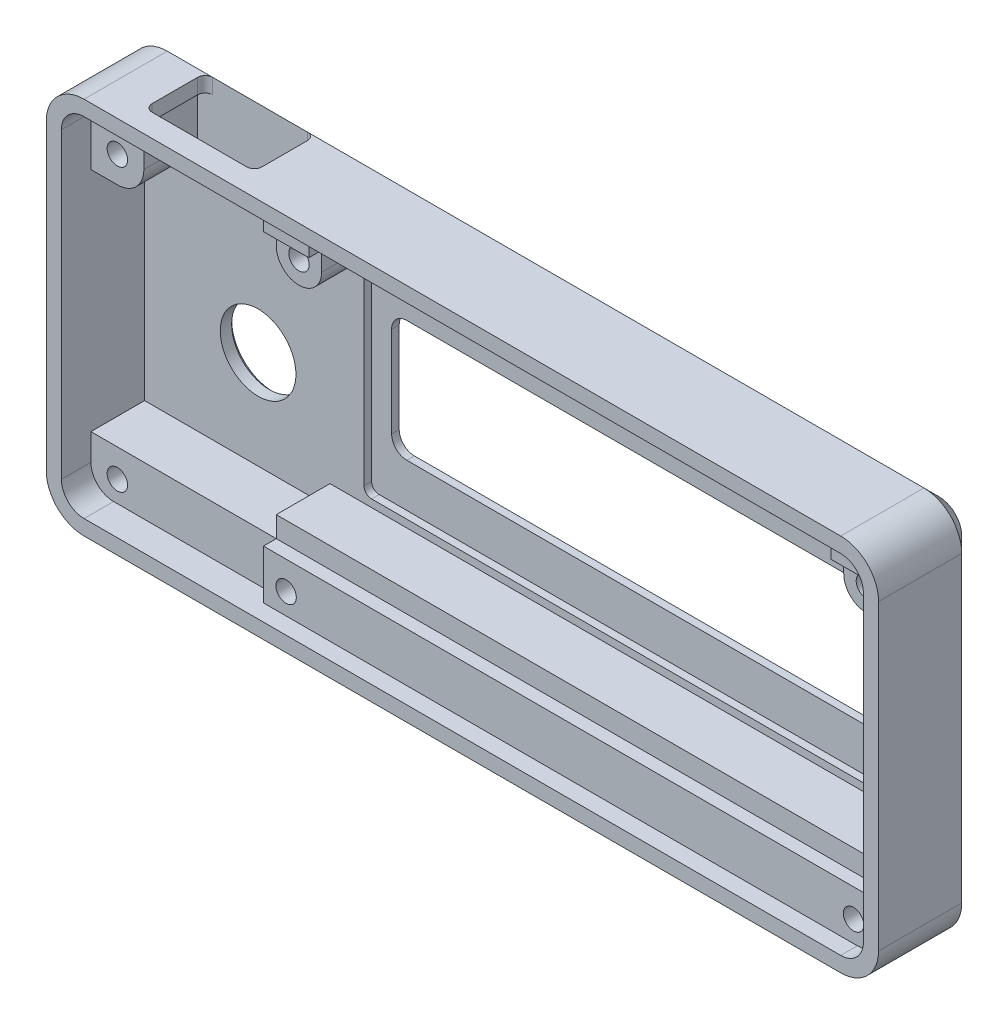
from build123d import *

# Parameters (mm, degrees)
SKICA1_W                    = 110
SKICA1_H                    = 50
P_IDAT_VYSUNUT_M1_DEPTH     = 13
SKO_EPINA1_T                = -2
SKICA3_W                    = 66.7
SKICA3_H                    = 16
ODEBRAT_VYSUNUT_M1_DEPTH    = 2
SKICA6_R                    = 1.35
SKICA6_W                    = 81.5
SKICA6_H                    = 9.25
P_IDAT_VYSUNUT_M3_DEPTH     = 7.1
SKICA8_W                    = 72
SKICA8_H                    = 27.5
ODEBRAT_VYSUNUT_M2_DEPTH    = 1
ZAOBLIT3_R                  = 1
ZAOBLIT4_R                  = 2
SKICA9_W                    = 81.5
SKICA9_H                    = 6.5
P_IDAT_VYSUNUT_M4_DEPTH     = 1.7
SKICA10_R                   = 1.35
ODEBRAT_VYSUNUT_M3_DEPTH    = 8.8
ZAOBLIT5_R                  = 5
ZAOBLIT6_R                  = 3
SKICA11_R                   = 5
ODEBRAT_VYSUNUT_M4_DEPTH    = 2
ZKOSEN_1_SIZE               = 2
P_IDAT_VYSUNUT_M5_OUTLINE_R = 1.35
P_IDAT_VYSUNUT_M5_DEPTH     = 7.1
SKICA13_W                   = 14.5
SKICA13_H                   = 8
ODEBRAT_VYSUNUT_M5_DEPTH    = 2
ZAOBLIT7_R                  = 1
ZAOBLIT8_R                  = 1
P_IDAT_START                = 1.7
SKICA14_W                   = 6
SKICA14_H                   = 3.5
P_IDAT_VYSUNUT_M6_DEPTH     = 1.7


# Read off the part's stored shape, not the designer's step: Přidat vysunutím5
with BuildPart() as part:
    # Skica1 → Přidat vysunutím1 (new body)
    with BuildSketch(Plane.XY):
        with Locations((55, 25)):
            Rectangle(SKICA1_W, SKICA1_H)
    extrude(amount=P_IDAT_VYSUNUT_M1_DEPTH)

    # Skořepina1
    sko_epina1_openings = [part.faces().sort_by_distance(p)[0] for p in [
        (55, 25, 13),
    ]]
    offset(amount=SKO_EPINA1_T, openings=sko_epina1_openings, kind=Kind.INTERSECTION)

    # Skica3 → Odebrat vysunutím1 (cut)
    with BuildSketch(Plane.XY.offset(2)):
        with Locations((67, 26)):
            Rectangle(SKICA3_W, SKICA3_H)
    extrude(amount=-ODEBRAT_VYSUNUT_M1_DEPTH, mode=Mode.SUBTRACT)

    # Skica6 → Přidat vysunutím3 (add)
    # profile 1 of 3: a face of its own
    with BuildSketch(Plane.XY.offset(2)):
        with BuildLine():
            Line((26.5, 42), (26.5, 48))
            Line((26.5, 48), (32.5, 48))
            Line((32.5, 48), (32.5, 42))
            ThreePointArc((32.5, 42), (29.5, 39), (26.5, 42))
        make_face()
        with Locations((29.5, 42)):
            Circle(SKICA6_R, mode=Mode.SUBTRACT)
    # profile 2 of 3: a face of its own
    with BuildSketch(Plane.XY.offset(2)):
        with BuildLine():
            Line((101.5, 42), (101.5, 48))
            Line((101.5, 48), (108, 48))
            Line((108, 48), (108, 39))
            Line((108, 39), (104.5, 39))
            ThreePointArc((104.5, 39), (102.378679656, 39.878679656), (101.5, 42))
        make_face()
        with Locations((104.5, 42)):
            Circle(SKICA6_R, mode=Mode.SUBTRACT)
    # profile 3 of 3: a face of its own
    with BuildSketch(Plane.XY.offset(2)):
        with Locations((67.25, 6.625)):
            Rectangle(SKICA6_W, SKICA6_H)
    extrude(amount=P_IDAT_VYSUNUT_M3_DEPTH)

    # Skica8 → Odebrat vysunutím2 (cut)
    with BuildSketch(Plane.XY.offset(2)):
        with Locations((67, 26)):
            Rectangle(SKICA8_W, SKICA8_H)
    extrude(amount=-ODEBRAT_VYSUNUT_M2_DEPTH, mode=Mode.SUBTRACT)

    # Zaoblit3
    # the kernel refuses this fillet: 1 mm, written as the material it adds along each edge
    with BuildSketch(Plane(origin=(31, 12.25, 2), x_dir=(1, 0, 0), z_dir=(0, 0, -1)), Plane(origin=(31, 39.75, 2), x_dir=(0, -1, 0), z_dir=(0, 0, -1))) as zaoblit3_piece_1:
        with BuildLine():
            CenterArc((ZAOBLIT3_R, -ZAOBLIT3_R), ZAOBLIT3_R, 90, 90)
            Line((0, -ZAOBLIT3_R), (0, 0))
            Line((0, 0), (ZAOBLIT3_R, 0))
        make_face()
    extrude(amount=1)
    with BuildSketch(Plane(origin=(103, 39.75, 2), x_dir=(0, -1, 0), z_dir=(0, 0, -1)), Plane(origin=(103, 12.25, 2), x_dir=(-1, 0, 0), z_dir=(0, 0, -1))) as zaoblit3_piece_2:
        with BuildLine():
            CenterArc((ZAOBLIT3_R, ZAOBLIT3_R), ZAOBLIT3_R, 180, 90)
            Line((0, ZAOBLIT3_R), (0, 0))
            Line((0, 0), (ZAOBLIT3_R, 0))
        make_face()
    extrude(amount=1)

    # Zaoblit4
    zaoblit4_edges = [part.edges().sort_by_distance(p)[0] for p in [
        (100.35, 18, 0.5),
        (100.35, 34, 0.5),
        (33.65, 34, 0.5),
        (33.65, 18, 0.5),
    ]]
    fillet(zaoblit4_edges, radius=ZAOBLIT4_R)

    # Skica9 → Přidat vysunutím4 (add)
    with BuildSketch(Plane.XY.offset(9.1)):
        with Locations((67.25, 5.25)):
            Rectangle(SKICA9_W, SKICA9_H)
    extrude(amount=P_IDAT_VYSUNUT_M4_DEPTH)

    # Skica10 → Odebrat vysunutím3 (cut)
    with BuildSketch(Plane.XY.offset(10.8)):
        with Locations((104.5, 4.796123071)):
            Circle(SKICA10_R)
        with Locations((29.5, 4.796123071)):
            Circle(SKICA10_R)
    extrude(amount=-ODEBRAT_VYSUNUT_M3_DEPTH, mode=Mode.SUBTRACT)

    # Zaoblit5
    zaoblit5_edges = [part.edges().sort_by_distance(p)[0] for p in [
        (0, 50, 6.5),
        (110, 50, 6.5),
        (110, 0, 6.5),
        (0, 0, 6.5),
    ]]
    fillet(zaoblit5_edges, radius=ZAOBLIT5_R)

    # Zaoblit6
    zaoblit6_edges = [part.edges().sort_by_distance(p)[0] for p in [
        (2, 48, 7.5),
        (2, 2, 7.5),
        (108, 2, 11.9),
        (108, 48, 11.05),
    ]]
    fillet(zaoblit6_edges, radius=ZAOBLIT6_R)

    # Skica11 → Odebrat vysunutím4 (cut)
    with BuildSketch(Plane(origin=(0, 0, 0), x_dir=(-1, 0, 0), z_dir=(0, 0, -1))):
        with Locations((-17, 21.5)):
            Circle(SKICA11_R)
    extrude(amount=-ODEBRAT_VYSUNUT_M4_DEPTH, mode=Mode.SUBTRACT)

    # Zkosení1
    zkosen_1_edges = [part.edges().sort_by_distance(p)[0] for p in [
        (55, 0, 0),
        (0, 25, 0),
        (55, 50, 0),
        (110, 25, 0),
        (1.464466094, 48.535533906, 0),
        (108.535533906, 48.535533906, 0),
        (108.535533906, 1.464466094, 0),
        (1.464466094, 1.464466094, 0),
    ]]
    chamfer(zkosen_1_edges, length=ZKOSEN_1_SIZE)

    # Přidat vysunutím5 outline → Přidat vysunutím5 (add)
    # profile 1 of 2: a face of its own
    with BuildSketch(Plane.XY.offset(2)):
        with BuildLine():
            Line((2, 45), (2, 38.5))
            Line((2, 38.5), (5.5, 38.5))
            ThreePointArc((5.5, 38.5), (7.974873734, 39.525126266), (9, 42))
            Line((9, 42), (9, 48))
            Line((9, 48), (5, 48))
            ThreePointArc((5, 48), (2.878679656, 47.121320344), (2, 45))
        make_face()
        with Locations((5.5, 42)):
            Circle(P_IDAT_VYSUNUT_M5_OUTLINE_R, mode=Mode.SUBTRACT)
    # profile 2 of 2: a face of its own
    with BuildSketch(Plane.XY.offset(2)):
        with BuildLine():
            Line((26.5, 8.5), (2, 8.5))
            Line((2, 8.5), (2, 5))
            ThreePointArc((2, 5), (2.878679656, 2.878679656), (5, 2))
            Line((5, 2), (26.5, 2))
            Line((26.5, 2), (26.5, 8.5))
        make_face()
        with Locations((5.5, 4.796123071)):
            Circle(P_IDAT_VYSUNUT_M5_OUTLINE_R, mode=Mode.SUBTRACT)
    extrude(amount=P_IDAT_VYSUNUT_M5_DEPTH)

    # P_idat vysunut_m5 2 outline → P_idat vysunut_m5 2 (revolve, cut)
    with BuildSketch(Plane(origin=(17, 21.5, 0), x_dir=(1, 0, 0), z_dir=(0, -1, 0))):
        Polygon((5.5, 0), (5, 0.5), (5, 0), align=None)
    revolve(axis=Axis((17, 21.5, 0), (0, 0, 1)), mode=Mode.SUBTRACT)

    # Skica13 → Odebrat vysunutím5 (cut)
    with BuildSketch(Plane.XZ.offset(-48)):
        with Locations((17.25, 6)):
            Rectangle(SKICA13_W, SKICA13_H)
    extrude(amount=-ODEBRAT_VYSUNUT_M5_DEPTH, mode=Mode.SUBTRACT)

    # Zaoblit7
    zaoblit7_edges = [part.edges().sort_by_distance(p)[0] for p in [
        (10, 49, 10),
        (24.5, 49, 10),
    ]]
    fillet(zaoblit7_edges, radius=ZAOBLIT7_R)

    # Zaoblit8
    zaoblit8_edges = [part.edges().sort_by_distance(p)[0] for p in [
        (10, 49, 2),
        (24.5, 49, 2),
    ]]
    fillet(zaoblit8_edges, radius=ZAOBLIT8_R)

    # Skica14 → Přidat vysunutím6 (add)
    with BuildSketch(Plane.XY.offset(9.1).offset(P_IDAT_START)):
        with Locations((29.5, 46.25)):
            Rectangle(SKICA14_W, SKICA14_H)
        with BuildLine():
            Line((101.5, 48), (105, 48))
            ThreePointArc((105, 48), (107.121320344, 47.121320344), (108, 45))
            Line((108, 45), (108, 44.5))
            Line((108, 44.5), (101.5, 44.5))
            Line((101.5, 44.5), (101.5, 48))
        make_face()
    extrude(amount=-P_IDAT_VYSUNUT_M6_DEPTH)


solid = part.part
